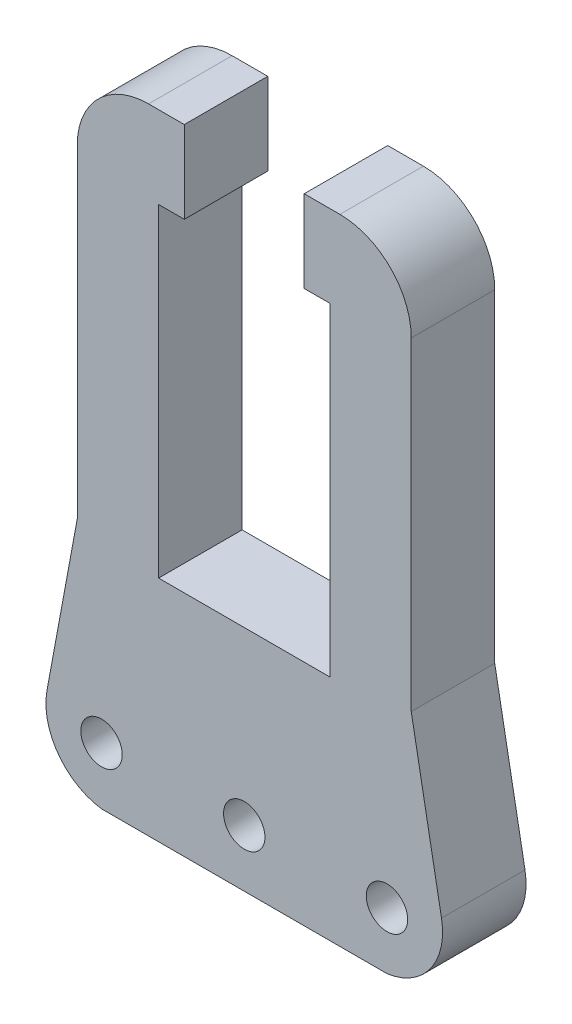
from build123d import *

# Parameters (mm, degrees)
MODEL_R             = 1.45
BOSS_EXTRUDE1_DEPTH = 5.85


with BuildPart() as part:
    # Model → Boss-Extrude1 (new body)
    with BuildSketch(Plane.XY):
        with BuildLine():
            Line((508.282236888, 554.934833401), (506.162292927, 543.461595882))
            ThreePointArc((506.162292927, 543.461595882), (506.942268074, 540.005189461), (509.982236888, 538.184833401))
            Line((509.982236888, 538.184833401), (529.982236888, 538.184833401))
            ThreePointArc((529.982236888, 538.184833401), (533.022205702, 540.005189461), (533.80218085, 543.461595882))
            Line((533.80218085, 543.461595882), (531.682236888, 554.934833401))
            Line((531.682236888, 554.934833401), (531.682236888, 577.604324401))
            ThreePointArc((531.682236888, 577.604324401), (530.217770794, 581.139858307), (526.682236888, 582.604324401))
            Line((526.682236888, 582.604324401), (524.182236888, 582.604324401))
            Line((524.182236888, 582.604324401), (524.182236888, 576.854324401))
            Line((524.182236888, 576.854324401), (525.982236888, 576.854324401))
            Line((525.982236888, 576.854324401), (525.982236888, 554.184833401))
            Line((525.982236888, 554.184833401), (513.982236888, 554.184833401))
            Line((513.982236888, 554.184833401), (513.982236888, 576.854324401))
            Line((513.982236888, 576.854324401), (515.782236888, 576.854324401))
            Line((515.782236888, 576.854324401), (515.782236888, 582.604324401))
            Line((515.782236888, 582.604324401), (513.282236888, 582.604324401))
            ThreePointArc((513.282236888, 582.604324401), (509.746702982, 581.139858307), (508.282236888, 577.604324401))
            Line((508.282236888, 577.604324401), (508.282236888, 554.934833401))
        make_face()
        with Locations((509.982236888, 542.184833401)):
            Circle(MODEL_R, mode=Mode.SUBTRACT)
        with Locations((519.982236888, 542.184833401)):
            Circle(MODEL_R, mode=Mode.SUBTRACT)
        with Locations((529.982236888, 542.184833401)):
            Circle(MODEL_R, mode=Mode.SUBTRACT)
    extrude(amount=BOSS_EXTRUDE1_DEPTH)


solid = part.part
